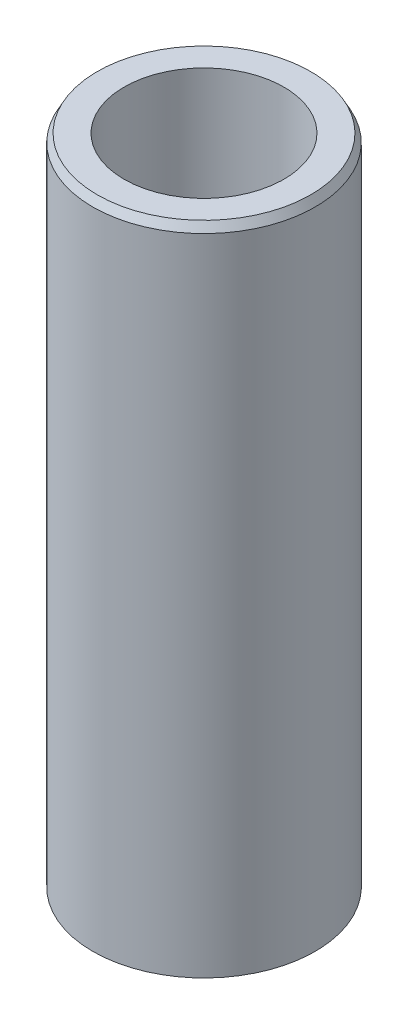
from build123d import *
from OCP.BRepFilletAPI import BRepFilletAPI_MakeChamfer

# Parameters (mm, degrees)
SKETCH1_R           = 57.5
BOSS_EXTRUDE1_DEPTH = 339.887566355
SKETCH2_R           = 41.313917402
CUT_EXTRUDE1_DEPTH  = 350.479695781
CHAMFER1_SIZE       = 4.305823521
CHAMFER1_SIZE2      = 2.307952672


with BuildPart() as part:
    # Sketch1 → Boss-Extrude1 (new body)
    with BuildSketch(Plane(origin=(0, 0, 0), x_dir=(1, 0, 0), z_dir=(0, 1, 0))):
        Circle(SKETCH1_R)
    extrude(amount=BOSS_EXTRUDE1_DEPTH)

    # Sketch2 → Cut-Extrude1 (cut, through all)
    with BuildSketch(Plane(origin=(0, 0, 0), x_dir=(1, 0, 0), z_dir=(0, 1, 0))):
        Circle(SKETCH2_R)
    extrude(amount=CUT_EXTRUDE1_DEPTH, mode=Mode.SUBTRACT)

    # Chamfer1: one chamfer whose edges measure the first distance from different faces: ONE call of the kernel's chamfer builder (chamfer() names one face for all edges)
    chamfer1_edges_1 = [part.edges().sort_by_distance(p)[0] for p in [
        (-57.5, 339.887566355, 0),
    ]]
    chamfer1_side_1 = [part.faces().sort_by_distance(p)[0] for p in [
        (-57.5, 169.943783178, 0),
    ]]
    chamfer1_edges_2 = [part.edges().sort_by_distance(p)[0] for p in [
        (-57.5, 0, 0),
    ]]
    chamfer1_side_2 = [part.faces().sort_by_distance(p)[0] for p in [
        (-55.873654403, 0, 0),
    ]]
    chamfer1 = BRepFilletAPI_MakeChamfer(part.part.solid().wrapped)
    for e in chamfer1_edges_1:
        chamfer1.Add(CHAMFER1_SIZE, CHAMFER1_SIZE2, e.wrapped, chamfer1_side_1[0].wrapped)  # the first distance lies on this face
    for e in chamfer1_edges_2:
        chamfer1.Add(CHAMFER1_SIZE, CHAMFER1_SIZE2, e.wrapped, chamfer1_side_2[0].wrapped)  # the first distance lies on this face
    add(Compound.cast(chamfer1.Shape()), mode=Mode.REPLACE)


solid = part.part
